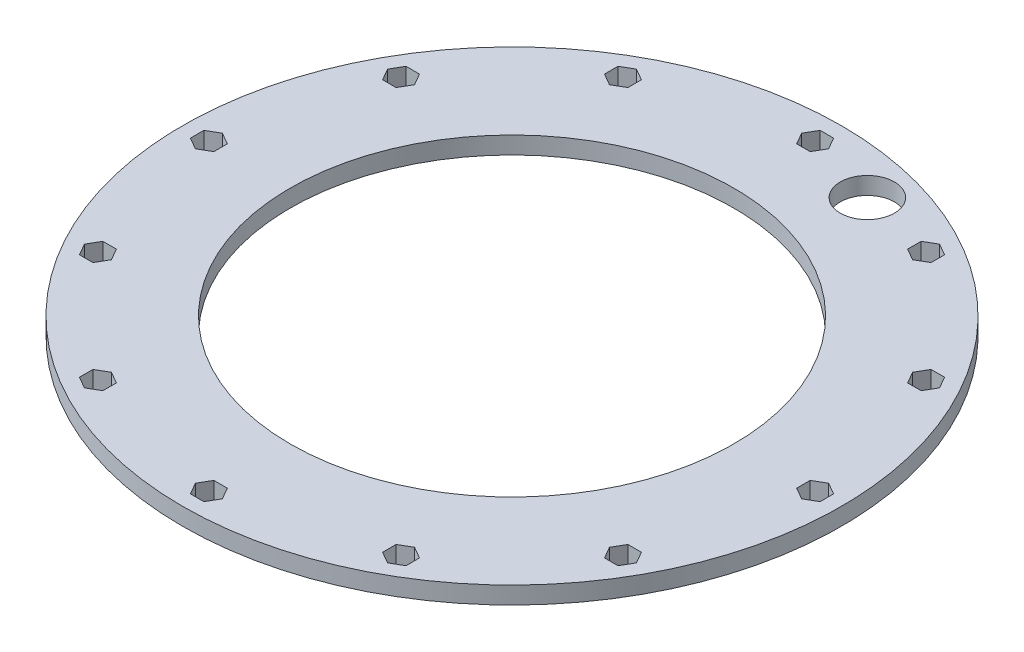
from build123d import *

# Parameters (mm, degrees)
SKETCH1_R           = 76.1
SKETCH1_R_2         = 51.2
BOSS_EXTRUDE1_DEPTH = 4
CUT_EXTRUDE1_DEPTH  = 108.695960927
SKETCH3_R           = 6.25
CUT_EXTRUDE2_DEPTH  = 10


with BuildPart() as part:
    # Sketch1 → Boss-Extrude1 (new body)
    with BuildSketch(Plane(origin=(0, 0, 0), x_dir=(1, 0, 0), z_dir=(0, 1, 0))):
        Circle(SKETCH1_R)
        Circle(SKETCH1_R_2, mode=Mode.SUBTRACT)
    extrude(amount=BOSS_EXTRUDE1_DEPTH)

    # Sketch2 → Cut-Extrude1 (cut, through all)
    with BuildSketch(Plane(origin=(0, 4, 0), x_dir=(1, 0, 0), z_dir=(0, 1, 0))):
        Polygon((37.7, 59.062932538), (37.7, 62.180623992), (35, 63.739469719), (32.3, 62.180623992), (32.3, 59.062932538), (35, 57.504086811), align=None)
        Polygon((3.117691454, 70), (1.558845727, 72.7), (-1.558845727, 72.7), (-3.117691454, 70), (-1.558845727, 67.3), (1.558845727, 67.3), align=None)
        Polygon((62.180623992, 32.3), (63.739469719, 35), (62.180623992, 37.7), (59.062932538, 37.7), (57.504086811, 35), (59.062932538, 32.3), align=None)
        Polygon((70, -3.117691454), (72.7, -1.558845727), (72.7, 1.558845727), (70, 3.117691454), (67.3, 1.558845727), (67.3, -1.558845727), align=None)
        Polygon((59.062932538, -37.7), (62.180623992, -37.7), (63.739469719, -35), (62.180623992, -32.3), (59.062932538, -32.3), (57.504086811, -35), align=None)
        Polygon((32.3, -62.180623992), (35, -63.739469719), (37.7, -62.180623992), (37.7, -59.062932538), (35, -57.504086811), (32.3, -59.062932538), align=None)
        Polygon((-3.117691454, -70), (-1.558845727, -72.7), (1.558845727, -72.7), (3.117691454, -70), (1.558845727, -67.3), (-1.558845727, -67.3), align=None)
        Polygon((-37.7, -59.062932538), (-37.7, -62.180623992), (-35, -63.739469719), (-32.3, -62.180623992), (-32.3, -59.062932538), (-35, -57.504086811), align=None)
        Polygon((-62.180623992, -32.3), (-63.739469719, -35), (-62.180623992, -37.7), (-59.062932538, -37.7), (-57.504086811, -35), (-59.062932538, -32.3), align=None)
        Polygon((-70, 3.117691454), (-72.7, 1.558845727), (-72.7, -1.558845727), (-70, -3.117691454), (-67.3, -1.558845727), (-67.3, 1.558845727), align=None)
        Polygon((-59.062932538, 37.7), (-62.180623992, 37.7), (-63.739469719, 35), (-62.180623992, 32.3), (-59.062932538, 32.3), (-57.504086811, 35), align=None)
        Polygon((-32.3, 62.180623992), (-35, 63.739469719), (-37.7, 62.180623992), (-37.7, 59.062932538), (-35, 57.504086811), (-32.3, 59.062932538), align=None)
    extrude(amount=-CUT_EXTRUDE1_DEPTH, mode=Mode.SUBTRACT)

    # Sketch3 → Cut-Extrude2 (cut)
    with BuildSketch(Plane(origin=(0, 4, 0), x_dir=(1, 0, 0), z_dir=(0, 1, 0))):
        with Locations((17.340876022, 64.717030361)):
            Circle(SKETCH3_R)
    extrude(amount=-CUT_EXTRUDE2_DEPTH, mode=Mode.SUBTRACT)


solid = part.part
